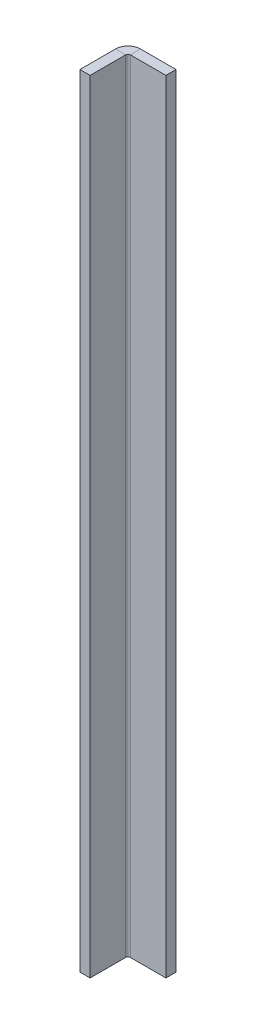
from build123d import *

# Parameters (mm, degrees)
SKETCH1_W                    = 3.175
SKETCH1_H                    = 244
BASE_FLANGE1_DEPTH           = 15
EDGE_FLANGE1_STRIP_W         = 14.1732
EDGE_FLANGE1_STRIP_H         = 3.175
EDGE_FLANGE1_STRIP_CUT_DEPTH = 244
EDGE_FLANGE1_DEPTH           = 244


# Sheet-metal steps are written as plain solids
with BuildPart() as part:
    # Sketch1 → Base-Flange1 (new body)
    with BuildSketch(Plane(origin=(0, 0, 0), x_dir=(0, 0, -1), z_dir=(1, 0, 0))):
        with Locations((1.5875, 0)):
            Rectangle(SKETCH1_W, SKETCH1_H)
    extrude(amount=BASE_FLANGE1_DEPTH)

    # Edge-Flange1 strip (across the edge) → Edge-Flange1 strip cut (cut)
    with BuildSketch(Plane.XZ.offset(-122)):
        with Locations((-3.175, -1.5875)):
            Rectangle(EDGE_FLANGE1_STRIP_W, EDGE_FLANGE1_STRIP_H)
    extrude(amount=EDGE_FLANGE1_STRIP_CUT_DEPTH, mode=Mode.SUBTRACT)

    # Edge-Flange1 section (across the edge) → Edge-Flange1 (add)
    with BuildSketch(Plane.XZ.offset(-122)):
        with BuildLine():
            Line((0, 0.7366), (0, 11.825))
            Line((0, 11.825), (3.175, 11.825))
            Line((3.175, 11.825), (3.175, 0.7366))
            ThreePointArc((3.175, 0.7366), (3.390745145, 0.215745145), (3.9116, 0))
            Line((3.9116, 0), (3.9116, -3.175))
            ThreePointArc((3.9116, -3.175), (1.145681115, -2.029318885), (0, 0.7366))
        make_face()
    extrude(amount=EDGE_FLANGE1_DEPTH)


solid = part.part
